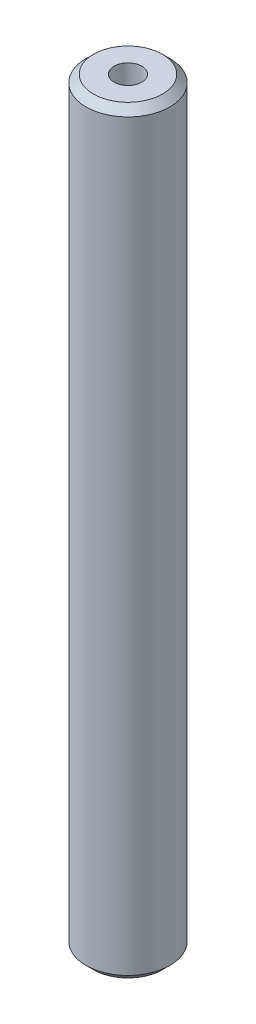
from build123d import *

# Parameters (mm, degrees)
SKETCH1_R           = 22.5
BOSS_EXTRUDE1_DEPTH = 407.071947922
SKETCH2_R           = 7.446811254
CUT_EXTRUDE1_DEPTH  = 409.313691645
CHAMFER1_SIZE       = 3.98644843


with BuildPart() as part:
    # Sketch1 → Boss-Extrude1 (new body)
    with BuildSketch(Plane(origin=(0, 0, 0), x_dir=(1, 0, 0), z_dir=(0, 1, 0))):
        Circle(SKETCH1_R)
    extrude(amount=BOSS_EXTRUDE1_DEPTH)

    # Sketch2 → Cut-Extrude1 (cut, through all)
    with BuildSketch(Plane(origin=(0, 0, 0), x_dir=(1, 0, 0), z_dir=(0, 1, 0))):
        Circle(SKETCH2_R)
    extrude(amount=CUT_EXTRUDE1_DEPTH, mode=Mode.SUBTRACT)

    # Chamfer1
    chamfer1_edges = [part.edges().sort_by_distance(p)[0] for p in [
        (-22.5, 407.071947922, 0),
        (-22.5, 0, 0),
    ]]
    chamfer(chamfer1_edges, length=CHAMFER1_SIZE)


solid = part.part
